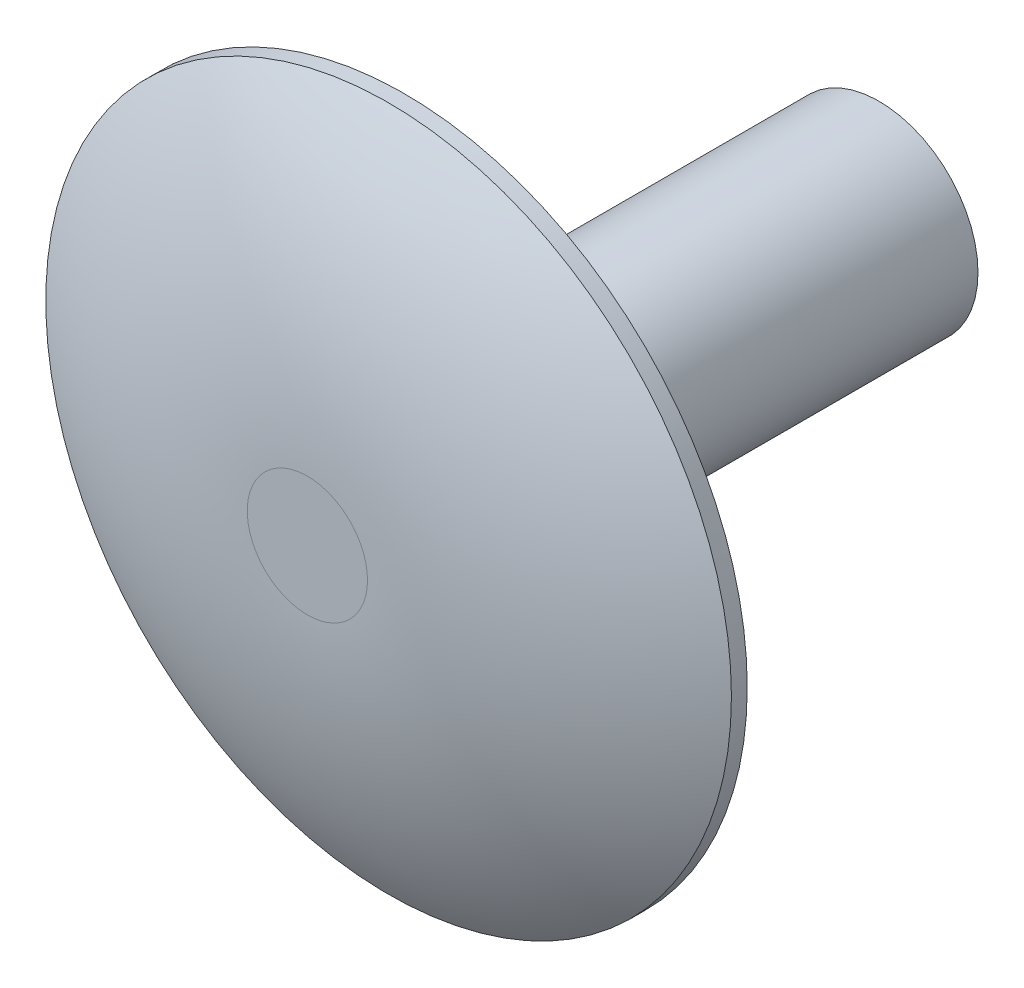
from build123d import *

# Parameters (mm, degrees)
SKETCH1_R           = 8.255
BOSS_EXTRUDE1_DEPTH = 2.3368
SKETCH2_R           = 2.38125
BOSS_EXTRUDE2_DEPTH = 11.43


with BuildPart() as part:
    # Sketch1 → Boss-Extrude1 (new body)
    with BuildSketch(Plane.XY):
        Circle(SKETCH1_R)
    extrude(amount=BOSS_EXTRUDE1_DEPTH)

    # Sketch2 → Boss-Extrude2 (add)
    with BuildSketch(Plane.XY):
        Circle(SKETCH2_R)
    extrude(amount=-BOSS_EXTRUDE2_DEPTH)

    # Sketch3 → Cut-Revolve1 (revolve, cut)
    with BuildSketch(Plane(origin=(0, 0, 0), x_dir=(1, 0, 0), z_dir=(0, 1, 0))):
        with BuildLine():
            Line((8.255, -2.3368), (8.255, -0.381))
            ThreePointArc((8.255, -0.381), (4.989096566, -1.838155581), (1.4478, -2.3368))
            Line((1.4478, -2.3368), (8.255, -2.3368))
        make_face()
    revolve(axis=Axis((0, 0, 2.3368), (0, 0, -1)), mode=Mode.SUBTRACT)


solid = part.part
